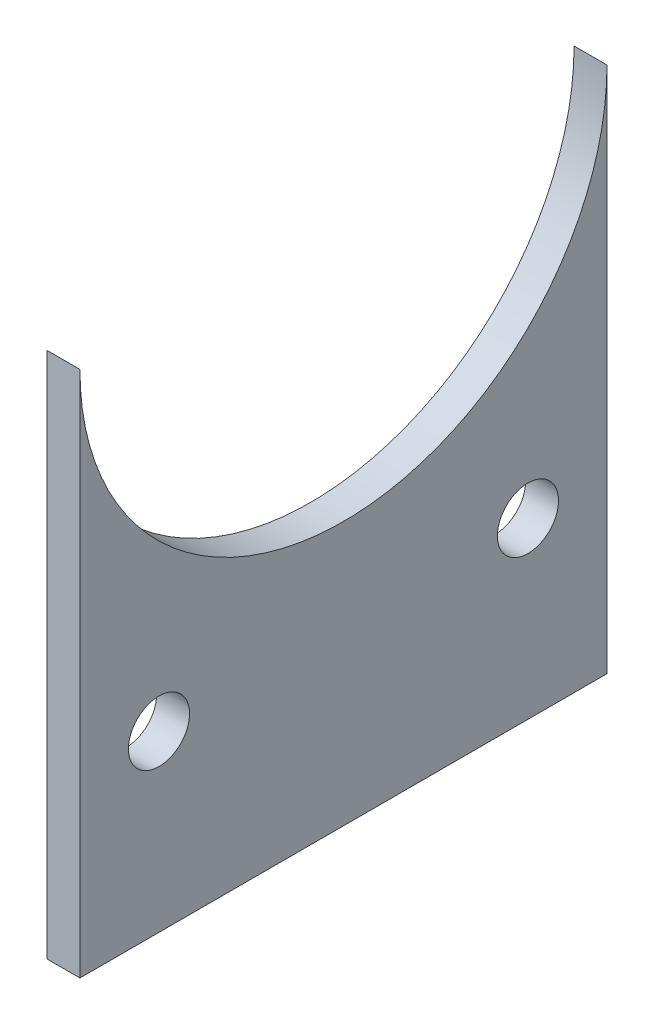
from build123d import *

# Parameters (mm, degrees)
BOSS_EXTRUDE1_DEPTH = 1.5875
SKETCH6_R           = 1.473196931
CUT_EXTRUDE2_DEPTH  = 19.030533998


with BuildPart() as part:
    # Sketch1 → Boss-Extrude1 (new body)
    with BuildSketch(Plane(origin=(0, 0, 0), x_dir=(0, 0, -1), z_dir=(1, 0, 0))):
        with BuildLine():
            Line((-12.7, -12.7), (12.7, -12.7))
            Line((12.7, -12.7), (12.7, 12.7))
            ThreePointArc((12.7, 12.7), (0, 0), (-12.7, 12.7))
            Line((-12.7, 12.7), (-12.7, -12.7))
        make_face()
    extrude(amount=BOSS_EXTRUDE1_DEPTH)

    # Sketch6 → Cut-Extrude2 (cut, symmetric)
    with BuildSketch(Plane.ZY):
        with Locations((-8.889941847, -4.308950185)):
            Circle(SKETCH6_R)
    cut_extrude2 = extrude(amount=CUT_EXTRUDE2_DEPTH, both=True, mode=Mode.SUBTRACT)

    # Mirror2: Cut-Extrude2 across plane
    add(cut_extrude2.mirror(Plane.XY), mode=Mode.SUBTRACT)


solid = part.part
